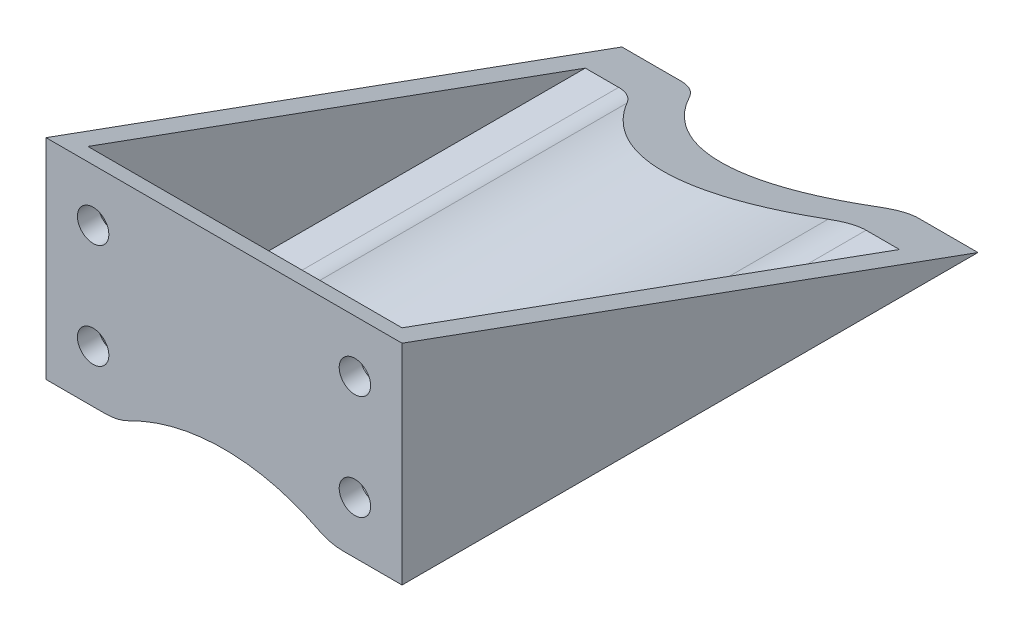
from build123d import *

# Parameters (mm, degrees)
SALIENTE_EXTRUIR3_DEPTH = 34
CROQUIS6_R              = 19.75
CORTAR_EXTRUIR2_DEPTH   = 68.683085036
VACIADO3_T              = -2
CROQUIS5_R              = 1.5
CORTAR_EXTRUIR3_DEPTH   = 10
REDONDEO1_R             = 5
REDONDEO3_R             = 5


with BuildPart() as part:
    # Croquis4 → Saliente-Extruir3 (new body)
    with BuildSketch(Plane(origin=(0, 0, 0), x_dir=(0, 0, -1), z_dir=(1, 0, 0))):
        Polygon((0, 0), (55, 0), (0, 20), align=None)
    extrude(amount=SALIENTE_EXTRUIR3_DEPTH)

    # Croquis6 → Cortar-Extruir2 (cut, through all)
    with BuildSketch(Plane.XY):
        with Locations((17, -17)):
            Circle(CROQUIS6_R)
    extrude(amount=-CORTAR_EXTRUIR2_DEPTH, mode=Mode.SUBTRACT)

    # Vaciado3
    vaciado3_openings = [part.faces().sort_by_distance(p)[0] for p in [
        (17, 10.517691614, -26.076348062),
    ]]
    offset(amount=VACIADO3_T, openings=vaciado3_openings, kind=Kind.INTERSECTION)

    # Croquis5 → Cortar-Extruir3 (cut)
    with BuildSketch(Plane.XY):
        with Locations((4.5, 15)):
            Circle(CROQUIS5_R)
        with Locations((29.5, 15)):
            Circle(CROQUIS5_R)
        with Locations((29.5, 5)):
            Circle(CROQUIS5_R)
        with Locations((4.5, 5)):
            Circle(CROQUIS5_R)
    extrude(amount=-CORTAR_EXTRUIR3_DEPTH, mode=Mode.SUBTRACT)

    # Redondeo1
    redondeo1_edges = [part.edges().sort_by_distance(p)[0] for p in [
        (6.947015369, 0, -27.5),
        (27.052984631, 0, -27.5),
    ]]
    fillet(redondeo1_edges, radius=REDONDEO1_R)

    # Redondeo3
    redondeo3_edges = [part.edges().sort_by_distance(p)[0] for p in [
        (27.58595768, 2, -25.75),
        (6.41404232, 2, -25.750000004),
    ]]
    fillet(redondeo3_edges, radius=REDONDEO3_R)


solid = part.part
